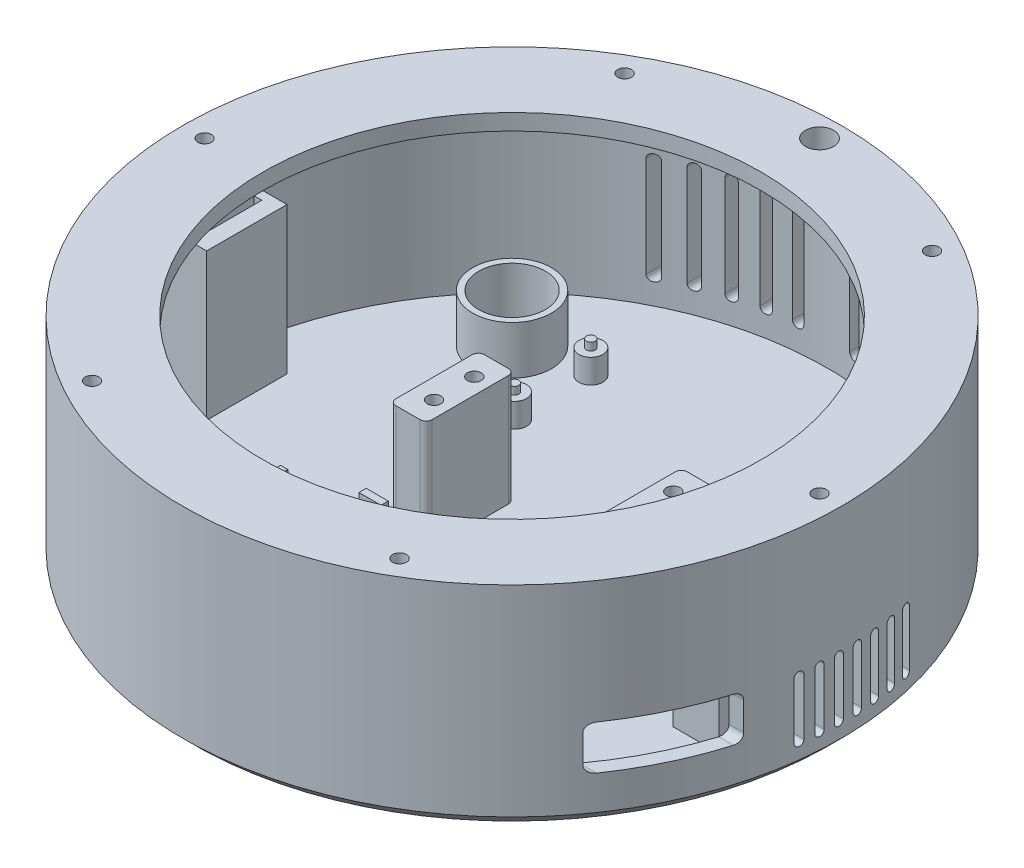
from build123d import *

# Parameters (mm, degrees)
PAN_START                   = 2.3
PAN_SERVO_PILLARS_DEPTH     = 27.9
PILLAR_START                = 17.2
SKETCH3_R                   = 1.7
PILLAR_BOLT_HOLES_DEPTH     = 13.2
PILLAR_START_2              = 21.5
PILLAR_NUT_SLOTS_DEPTH      = 2.7
SERVO_START                 = 2.3
SKETCH5_W                   = 10.2
SKETCH5_H                   = 9
SERVO_LEAD_NOTCH_DEPTH      = 10.7
PCA9685_START               = 2.3
SKETCH6_R                   = 3
PCA9685_POSTS_DEPTH         = 6.2
PCA9685_START_2             = 8.3
SKETCH7_R                   = 1.1
PCA9685_LOCATING_PINS_DEPTH = 2.1
ESP32_START                 = 2.3
SKETCH8_R                   = 2.7
ESP32_POSTS_DEPTH           = 10.2
SKETCH9_W                   = 5.5
SKETCH9_H                   = 1.8
ESP32_FENCES_DEPTH          = 13.2
AMP_START                   = 2.3
SKETCH10_R                  = 2.7
AMP_POSTS_DEPTH             = 7.7
SKETCH11_W                  = 1.8
SKETCH11_H                  = 5
AMP_FENCES_DEPTH            = 10.7
SPEAKER_START               = 2.3
SKETCH12_W                  = 11.5
SKETCH12_H                  = 3
SPEAKER_RAILS_DEPTH         = 24.2
SPEAKER_START_2             = 3.5
SKETCH13_W                  = 6.1
SKETCH13_H                  = 1.5
SPEAKER_GROOVES_DEPTH       = 23.2
MIC_START                   = 2.3
SKETCH14_W                  = 13.5
SKETCH14_H                  = 20
MIC_BLOCK_DEPTH             = 36.7
MIC_START_2                 = 22
SKETCH15_W                  = 1.9
SKETCH15_H                  = 15.6
MIC_SLOT_DEPTH              = 17.2
MIC_START_3                 = -90
SKETCH16_R                  = 1.25
MIC_PORT_DEPTH              = 19
CAP_START                   = 2.3
SKETCH17_R                  = 9.8
SKETCH17_R_2                = 8.3
CAP_CLIP_DEPTH              = 12.2
SPEAKER_START_3             = 66
SPEAKER_GRILLE_DEPTH        = 24
USB_START                   = 46
USB_WINDOW_DEPTH            = 44
BACK_START                  = -90
BACK_VENTS_DEPTH            = 30
RING_START                  = 46.8
SKETCH21_R                  = 1.7
RING_BOLT_HOLES_DEPTH       = 6.4
RING_NUT_POCKETS_DEPTH      = 2.9
MX_START                    = 46.8
SKETCH23_R                  = 3.5
MX_LEAD_HOLE_DEPTH          = 6.4


with BuildPart() as part:
    # Sketch1 → Shell + slew ring (revolve)
    with BuildSketch(Plane.XY):
        Polygon((0, 0), (79, 0), (82, 3), (82, 53), (62, 53), (62, 49), (70.5, 49), (70.5, 47), (78.5, 47), (78.5, 2.5), (0, 2.5), align=None)
    revolve(axis=Axis((0, -5, 0), (0, 1, 0)))

    # Sketch2 → Pan servo pillars (add)
    with BuildSketch(Plane(origin=(0, 0, 0), x_dir=(1, 0, 0), z_dir=(0, 1, 0)).offset(PAN_START)):
        with BuildLine():
            Line((-17.9, 11), (-11.9, 11))
            ThreePointArc((-11.9, 11), (-10.839339828, 10.560660172), (-10.4, 9.5))
            Line((-10.4, 9.5), (-10.4, -9.5))
            ThreePointArc((-10.4, -9.5), (-10.839339828, -10.560660172), (-11.9, -11))
            Line((-11.9, -11), (-17.9, -11))
            ThreePointArc((-17.9, -11), (-18.960660172, -10.560660172), (-19.4, -9.5))
            Line((-19.4, -9.5), (-19.4, 9.5))
            ThreePointArc((-19.4, 9.5), (-18.960660172, 10.560660172), (-17.9, 11))
        make_face()
        with BuildLine():
            Line((32.6, 11), (38.6, 11))
            ThreePointArc((38.6, 11), (39.660660172, 10.560660172), (40.1, 9.5))
            Line((40.1, 9.5), (40.1, -9.5))
            ThreePointArc((40.1, -9.5), (39.660660172, -10.560660172), (38.6, -11))
            Line((38.6, -11), (32.6, -11))
            ThreePointArc((32.6, -11), (31.539339828, -10.560660172), (31.1, -9.5))
            Line((31.1, -9.5), (31.1, 9.5))
            ThreePointArc((31.1, 9.5), (31.539339828, 10.560660172), (32.6, 11))
        make_face()
    extrude(amount=PAN_SERVO_PILLARS_DEPTH)

    # Sketch3 → Pillar bolt holes (cut)
    with BuildSketch(Plane(origin=(0, 0, 0), x_dir=(1, 0, 0), z_dir=(0, 1, 0)).offset(PILLAR_START)):
        with Locations((-14.4, 5)):
            Circle(SKETCH3_R)
        with Locations((-14.4, -5)):
            Circle(SKETCH3_R)
        with Locations((35.1, 5)):
            Circle(SKETCH3_R)
        with Locations((35.1, -5)):
            Circle(SKETCH3_R)
    extrude(amount=PILLAR_BOLT_HOLES_DEPTH, mode=Mode.SUBTRACT)

    # Sketch4 → Pillar nut slots (cut)
    with BuildSketch(Plane(origin=(0, 0, 0), x_dir=(1, 0, 0), z_dir=(0, 1, 0)).offset(PILLAR_START_2)):
        Polygon((-16.103183294, 7.95), (-12.696816706, 7.95), (-10.993633412, 5), (-12.696816706, 2.05), (-16.103183294, 2.05), (-19.9, 2.05), (-19.9, 7.95), align=None)
        Polygon((-16.103183294, -2.05), (-12.696816706, -2.05), (-10.993633412, -5), (-12.696816706, -7.95), (-16.103183294, -7.95), (-19.9, -7.95), (-19.9, -2.05), align=None)
        Polygon((36.803183294, 2.05), (33.396816706, 2.05), (31.693633412, 5), (33.396816706, 7.95), (36.803183294, 7.95), (40.6, 7.95), (40.6, 2.05), align=None)
        Polygon((36.803183294, -7.95), (33.396816706, -7.95), (31.693633412, -5), (33.396816706, -2.05), (36.803183294, -2.05), (40.6, -2.05), (40.6, -7.95), align=None)
    extrude(amount=PILLAR_NUT_SLOTS_DEPTH, mode=Mode.SUBTRACT)

    # Sketch5 → Servo lead notch (cut)
    with BuildSketch(Plane(origin=(0, 0, 0), x_dir=(1, 0, 0), z_dir=(0, 1, 0)).offset(SERVO_START)):
        with Locations((35.6, 0)):
            Rectangle(SKETCH5_W, SKETCH5_H)
    extrude(amount=SERVO_LEAD_NOTCH_DEPTH, mode=Mode.SUBTRACT)

    # Sketch6 → PCA9685 posts (add)
    with BuildSketch(Plane(origin=(0, 0, 0), x_dir=(1, 0, 0), z_dir=(0, 1, 0)).offset(PCA9685_START)):
        with Locations((-27.9, 47.5)):
            Circle(SKETCH6_R)
        with Locations((-27.9, 28.5)):
            Circle(SKETCH6_R)
        with Locations((27.9, 47.5)):
            Circle(SKETCH6_R)
        with Locations((27.9, 28.5)):
            Circle(SKETCH6_R)
    extrude(amount=PCA9685_POSTS_DEPTH)

    # Sketch7 → PCA9685 locating pins (add)
    with BuildSketch(Plane(origin=(0, 0, 0), x_dir=(1, 0, 0), z_dir=(0, 1, 0)).offset(PCA9685_START_2)):
        with Locations((-27.9, 47.5)):
            Circle(SKETCH7_R)
        with Locations((-27.9, 28.5)):
            Circle(SKETCH7_R)
        with Locations((27.9, 47.5)):
            Circle(SKETCH7_R)
        with Locations((27.9, 28.5)):
            Circle(SKETCH7_R)
    extrude(amount=PCA9685_LOCATING_PINS_DEPTH)

    # Sketch8 → ESP32 posts (add)
    with BuildSketch(Plane(origin=(0, 0, 0), x_dir=(1, 0, 0), z_dir=(0, 1, 0)).offset(ESP32_START)):
        with Locations((-16.5, -26.5)):
            Circle(SKETCH8_R)
        with Locations((-16.5, -43.5)):
            Circle(SKETCH8_R)
        with Locations((39.5, -26.5)):
            Circle(SKETCH8_R)
        with Locations((39.5, -43.5)):
            Circle(SKETCH8_R)
    extrude(amount=ESP32_POSTS_DEPTH)

    # Sketch9 → ESP32 fences (add)
    with BuildSketch(Plane(origin=(0, 0, 0), x_dir=(1, 0, 0), z_dir=(0, 1, 0)).offset(ESP32_START)):
        with Locations((-15.75, -18.7)):
            Rectangle(SKETCH9_W, SKETCH9_H)
        with Locations((-15.75, -51.3)):
            Rectangle(SKETCH9_W, SKETCH9_H)
        with Locations((41.75, -18.7)):
            Rectangle(SKETCH9_W, SKETCH9_H)
        with Locations((41.75, -51.3)):
            Rectangle(SKETCH9_W, SKETCH9_H)
    extrude(amount=ESP32_FENCES_DEPTH)

    # Sketch10 → Amp posts (add)
    with BuildSketch(Plane(origin=(0, 0, 0), x_dir=(1, 0, 0), z_dir=(0, 1, 0)).offset(AMP_START)):
        with Locations((-54.5, -27.5)):
            Circle(SKETCH10_R)
        with Locations((-54.5, -36)):
            Circle(SKETCH10_R)
        with Locations((-39.5, -27.5)):
            Circle(SKETCH10_R)
        with Locations((-39.5, -36)):
            Circle(SKETCH10_R)
    extrude(amount=AMP_POSTS_DEPTH)

    # Sketch11 → Amp fences (add)
    with BuildSketch(Plane(origin=(0, 0, 0), x_dir=(1, 0, 0), z_dir=(0, 1, 0)).offset(AMP_START)):
        with Locations((-58.3, -23.5)):
            Rectangle(SKETCH11_W, SKETCH11_H)
        with Locations((-58.3, -36.5)):
            Rectangle(SKETCH11_W, SKETCH11_H)
        with Locations((-35.7, -23.5)):
            Rectangle(SKETCH11_W, SKETCH11_H)
        with Locations((-35.7, -36.5)):
            Rectangle(SKETCH11_W, SKETCH11_H)
    extrude(amount=AMP_FENCES_DEPTH)

    # Sketch12 → Speaker rails (add)
    with BuildSketch(Plane(origin=(0, 0, 0), x_dir=(1, 0, 0), z_dir=(0, 1, 0)).offset(SPEAKER_START)):
        with Locations((63.75, -16.5)):
            Rectangle(SKETCH12_W, SKETCH12_H)
        with Locations((63.75, 24.5)):
            Rectangle(SKETCH12_W, SKETCH12_H)
    extrude(amount=SPEAKER_RAILS_DEPTH)

    # Sketch13 → Speaker grooves (cut)
    with BuildSketch(Plane(origin=(0, 0, 0), x_dir=(1, 0, 0), z_dir=(0, 1, 0)).offset(SPEAKER_START_2)):
        with Locations((63.75, -15.65)):
            Rectangle(SKETCH13_W, SKETCH13_H)
        with Locations((63.75, 23.65)):
            Rectangle(SKETCH13_W, SKETCH13_H)
    extrude(amount=SPEAKER_GROOVES_DEPTH, mode=Mode.SUBTRACT)

    # Sketch14 → Mic block (add)
    with BuildSketch(Plane(origin=(0, 0, 0), x_dir=(1, 0, 0), z_dir=(0, 1, 0)).offset(MIC_START)):
        with Locations((-72.75, 0)):
            Rectangle(SKETCH14_W, SKETCH14_H)
    extrude(amount=MIC_BLOCK_DEPTH)

    # Sketch15 → Mic slot (cut)
    with BuildSketch(Plane(origin=(0, 0, 0), x_dir=(1, 0, 0), z_dir=(0, 1, 0)).offset(MIC_START_2)):
        with Locations((-71, 0)):
            Rectangle(SKETCH15_W, SKETCH15_H)
    extrude(amount=MIC_SLOT_DEPTH, mode=Mode.SUBTRACT)

    # Sketch16 → Mic port (cut)
    with BuildSketch(Plane(origin=(0, 0, 0), x_dir=(0, 0, -1), z_dir=(1, 0, 0)).offset(MIC_START_3)):
        with Locations((0, 30)):
            Circle(SKETCH16_R)
    extrude(amount=MIC_PORT_DEPTH, mode=Mode.SUBTRACT)

    # Sketch17 → Cap clip (add)
    with BuildSketch(Plane(origin=(0, 0, 0), x_dir=(1, 0, 0), z_dir=(0, 1, 0)).offset(CAP_START)):
        with Locations((-44, 44)):
            Circle(SKETCH17_R)
        with Locations((-44, 44)):
            Circle(SKETCH17_R_2, mode=Mode.SUBTRACT)
    extrude(amount=CAP_CLIP_DEPTH)

    # Sketch18 → Speaker grille (cut)
    with BuildSketch(Plane(origin=(0, 0, 0), x_dir=(0, 0, -1), z_dir=(1, 0, 0)).offset(SPEAKER_START_3)):
        with BuildLine():
            Line((16.9, 7), (16.9, 21))
            ThreePointArc((16.9, 21), (18, 22.1), (19.1, 21))
            Line((19.1, 21), (19.1, 7))
            ThreePointArc((19.1, 7), (18, 5.9), (16.9, 7))
        make_face()
        with BuildLine():
            Line((12.233333333, 7), (12.233333333, 21))
            ThreePointArc((12.233333333, 21), (13.333333333, 22.1), (14.433333333, 21))
            Line((14.433333333, 21), (14.433333333, 7))
            ThreePointArc((14.433333333, 7), (13.333333333, 5.9), (12.233333333, 7))
        make_face()
        with BuildLine():
            Line((7.566666667, 7), (7.566666667, 21))
            ThreePointArc((7.566666667, 21), (8.666666667, 22.1), (9.766666667, 21))
            Line((9.766666667, 21), (9.766666667, 7))
            ThreePointArc((9.766666667, 7), (8.666666667, 5.9), (7.566666667, 7))
        make_face()
        with BuildLine():
            Line((2.9, 7), (2.9, 21))
            ThreePointArc((2.9, 21), (4, 22.1), (5.1, 21))
            Line((5.1, 21), (5.1, 7))
            ThreePointArc((5.1, 7), (4, 5.9), (2.9, 7))
        make_face()
        with BuildLine():
            Line((-1.766666667, 7), (-1.766666667, 21))
            ThreePointArc((-1.766666667, 21), (-0.666666667, 22.1), (0.433333333, 21))
            Line((0.433333333, 21), (0.433333333, 7))
            ThreePointArc((0.433333333, 7), (-0.666666667, 5.9), (-1.766666667, 7))
        make_face()
        with BuildLine():
            Line((-6.433333333, 7), (-6.433333333, 21))
            ThreePointArc((-6.433333333, 21), (-5.333333333, 22.1), (-4.233333333, 21))
            Line((-4.233333333, 21), (-4.233333333, 7))
            ThreePointArc((-4.233333333, 7), (-5.333333333, 5.9), (-6.433333333, 7))
        make_face()
        with BuildLine():
            Line((-11.1, 7), (-11.1, 21))
            ThreePointArc((-11.1, 21), (-10, 22.1), (-8.9, 21))
            Line((-8.9, 21), (-8.9, 7))
            ThreePointArc((-8.9, 7), (-10, 5.9), (-11.1, 7))
        make_face()
    extrude(amount=SPEAKER_GRILLE_DEPTH, mode=Mode.SUBTRACT)

    # Sketch19 → USB window (cut)
    with BuildSketch(Plane(origin=(0, 0, 0), x_dir=(0, 0, -1), z_dir=(1, 0, 0)).offset(USB_START)):
        with BuildLine():
            Line((-21.5, 13.5), (-21.5, 20.5))
            ThreePointArc((-21.5, 20.5), (-22.085786438, 21.914213562), (-23.5, 22.5))
            Line((-23.5, 22.5), (-46.5, 22.5))
            ThreePointArc((-46.5, 22.5), (-47.914213562, 21.914213562), (-48.5, 20.5))
            Line((-48.5, 20.5), (-48.5, 13.5))
            ThreePointArc((-48.5, 13.5), (-47.914213562, 12.085786438), (-46.5, 11.5))
            Line((-46.5, 11.5), (-23.5, 11.5))
            ThreePointArc((-23.5, 11.5), (-22.085786438, 12.085786438), (-21.5, 13.5))
        make_face()
    extrude(amount=USB_WINDOW_DEPTH, mode=Mode.SUBTRACT)

    # Sketch20 → Back vents (cut)
    with BuildSketch(Plane.XY.offset(BACK_START)):
        with BuildLine():
            Line((-36.3, 9), (-36.3, 34))
            ThreePointArc((-36.3, 34), (-35, 35.3), (-33.7, 34))
            Line((-33.7, 34), (-33.7, 9))
            ThreePointArc((-33.7, 9), (-35, 7.7), (-36.3, 9))
        make_face()
        with BuildLine():
            Line((-29.3, 9), (-29.3, 34))
            ThreePointArc((-29.3, 34), (-28, 35.3), (-26.7, 34))
            Line((-26.7, 34), (-26.7, 9))
            ThreePointArc((-26.7, 9), (-28, 7.7), (-29.3, 9))
        make_face()
        with BuildLine():
            Line((-22.3, 9), (-22.3, 34))
            ThreePointArc((-22.3, 34), (-21, 35.3), (-19.7, 34))
            Line((-19.7, 34), (-19.7, 9))
            ThreePointArc((-19.7, 9), (-21, 7.7), (-22.3, 9))
        make_face()
        with BuildLine():
            Line((-15.3, 9), (-15.3, 34))
            ThreePointArc((-15.3, 34), (-14, 35.3), (-12.7, 34))
            Line((-12.7, 34), (-12.7, 9))
            ThreePointArc((-12.7, 9), (-14, 7.7), (-15.3, 9))
        make_face()
        with BuildLine():
            Line((-8.3, 9), (-8.3, 34))
            ThreePointArc((-8.3, 34), (-7, 35.3), (-5.7, 34))
            Line((-5.7, 34), (-5.7, 9))
            ThreePointArc((-5.7, 9), (-7, 7.7), (-8.3, 9))
        make_face()
        with BuildLine():
            Line((5.7, 9), (5.7, 34))
            ThreePointArc((5.7, 34), (7, 35.3), (8.3, 34))
            Line((8.3, 34), (8.3, 9))
            ThreePointArc((8.3, 9), (7, 7.7), (5.7, 9))
        make_face()
        with BuildLine():
            Line((12.7, 9), (12.7, 34))
            ThreePointArc((12.7, 34), (14, 35.3), (15.3, 34))
            Line((15.3, 34), (15.3, 9))
            ThreePointArc((15.3, 9), (14, 7.7), (12.7, 9))
        make_face()
        with BuildLine():
            Line((19.7, 9), (19.7, 34))
            ThreePointArc((19.7, 34), (21, 35.3), (22.3, 34))
            Line((22.3, 34), (22.3, 9))
            ThreePointArc((22.3, 9), (21, 7.7), (19.7, 9))
        make_face()
        with BuildLine():
            Line((26.7, 9), (26.7, 34))
            ThreePointArc((26.7, 34), (28, 35.3), (29.3, 34))
            Line((29.3, 34), (29.3, 9))
            ThreePointArc((29.3, 9), (28, 7.7), (26.7, 9))
        make_face()
        with BuildLine():
            Line((33.7, 9), (33.7, 34))
            ThreePointArc((33.7, 34), (35, 35.3), (36.3, 34))
            Line((36.3, 34), (36.3, 9))
            ThreePointArc((36.3, 9), (35, 7.7), (33.7, 9))
        make_face()
    extrude(amount=BACK_VENTS_DEPTH, mode=Mode.SUBTRACT)

    # Sketch21 → Ring bolt holes (cut)
    with BuildSketch(Plane(origin=(0, 0, 0), x_dir=(1, 0, 0), z_dir=(0, 1, 0)).offset(RING_START)):
        with Locations((76.5, 0)):
            Circle(SKETCH21_R)
        with Locations((38.25, -66.25094339)):
            Circle(SKETCH21_R)
        with Locations((-38.25, -66.25094339)):
            Circle(SKETCH21_R)
        with Locations((-76.5, 0)):
            Circle(SKETCH21_R)
        with Locations((-38.25, 66.25094339)):
            Circle(SKETCH21_R)
        with Locations((38.25, 66.25094339)):
            Circle(SKETCH21_R)
    extrude(amount=RING_BOLT_HOLES_DEPTH, mode=Mode.SUBTRACT)

    # Sketch22 → Ring nut pockets (cut)
    with BuildSketch(Plane(origin=(0, 0, 0), x_dir=(1, 0, 0), z_dir=(0, 1, 0)).offset(RING_START)):
        Polygon((79.35, -1.645448267), (76.5, -3.290896534), (73.65, -1.645448267), (73.65, 1.645448267), (76.5, 3.290896534), (79.35, 1.645448267), align=None)
        Polygon((38.25, -69.541839924), (35.4, -67.896391657), (35.4, -64.605495122), (38.25, -62.960046855), (41.1, -64.605495122), (41.1, -67.896391657), align=None)
        Polygon((-41.1, -67.896391657), (-41.1, -64.605495122), (-38.25, -62.960046855), (-35.4, -64.605495122), (-35.4, -67.896391657), (-38.25, -69.541839924), align=None)
        Polygon((-79.35, 1.645448267), (-76.5, 3.290896534), (-73.65, 1.645448267), (-73.65, -1.645448267), (-76.5, -3.290896534), (-79.35, -1.645448267), align=None)
        Polygon((-38.25, 69.541839924), (-35.4, 67.896391657), (-35.4, 64.605495122), (-38.25, 62.960046855), (-41.1, 64.605495122), (-41.1, 67.896391657), align=None)
        Polygon((41.1, 67.896391657), (41.1, 64.605495122), (38.25, 62.960046855), (35.4, 64.605495122), (35.4, 67.896391657), (38.25, 69.541839924), align=None)
    extrude(amount=RING_NUT_POCKETS_DEPTH, mode=Mode.SUBTRACT)

    # Sketch23 → MX lead hole (cut)
    with BuildSketch(Plane(origin=(0, 0, 0), x_dir=(1, 0, 0), z_dir=(0, 1, 0)).offset(MX_START)):
        with Locations((0, 76.5)):
            Circle(SKETCH23_R)
    extrude(amount=MX_LEAD_HOLE_DEPTH, mode=Mode.SUBTRACT)


solid = part.part
